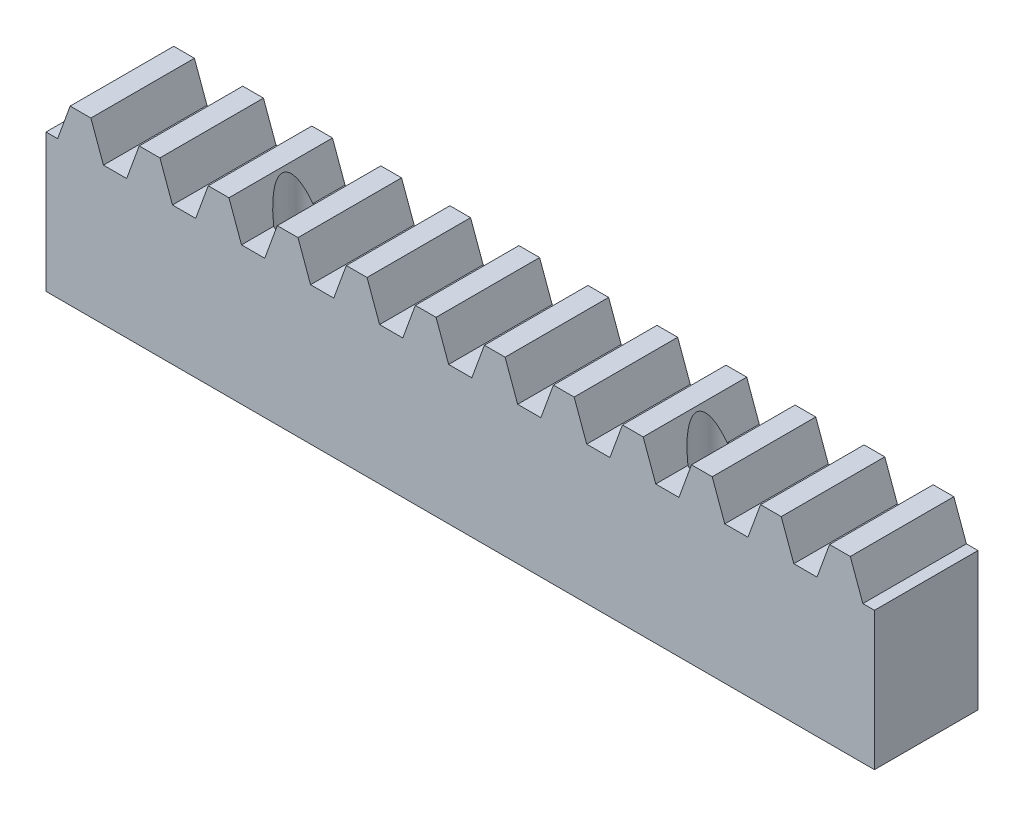
from build123d import *

# Parameters (mm, degrees)
EXTRUDE_START       = -7.5
EXTRUDE_1_DEPTH     = 15
SKETCH_2_R          = 5.5
CUT_EXTRUDE_1_DEPTH = 6
SKETCH_3_R          = 3.3
CUT_EXTRUDE_2_DEPTH = 123.805740908


# Read off the part's stored shape, not the designer's step: 凸台-拉伸1
with BuildPart() as part:
    # 凸台-拉伸1 outline → 凸台-拉伸1 (new body)
    with BuildSketch(Plane.XY.offset(EXTRUDE_START)):
        Polygon((0, 0), (120, 0), (120, 20), (118.319851, 20), (116.5, 25), (113.5, 25), (111.680149, 20), (108.319851, 20), (106.5, 25), (103.5, 25), (101.680149, 20), (98.319851, 20), (96.5, 25), (93.5, 25), (91.680149, 20), (88.319851, 20), (86.5, 25), (83.5, 25), (81.680149, 20), (78.319851, 20), (76.5, 25), (73.5, 25), (71.680149, 20), (68.319851, 20), (66.5, 25), (63.5, 25), (61.680149, 20), (58.319851, 20), (56.5, 25), (53.5, 25), (51.680149, 20), (48.319851, 20), (46.5, 25), (43.5, 25), (41.680149, 20), (38.319851, 20), (36.5, 25), (33.5, 25), (31.680149, 20), (28.319851, 20), (26.5, 25), (23.5, 25), (21.680149, 20), (18.319851, 20), (16.5, 25), (13.5, 25), (11.680149, 20), (8.319851, 20), (6.5, 25), (3.5, 25), (1.680149, 20), (0, 20), align=None)
    extrude(amount=EXTRUDE_1_DEPTH)

    # 草图2 → 切除-拉伸1 (cut)
    with BuildSketch(Plane(origin=(0, 0, 0), x_dir=(1, 0, 0), z_dir=(0, 1, 0))):
        with Locations(Location((30, 0, 0), (0, 0, 270))):
            Circle(SKETCH_2_R)
        with Locations(Location((90, 0, 0), (0, 0, 270))):
            Circle(SKETCH_2_R)
    extrude(amount=CUT_EXTRUDE_1_DEPTH, mode=Mode.SUBTRACT)

    # 草图3 → 切除-拉伸2 (cut, through all)
    with BuildSketch(Plane(origin=(0, 0, 0), x_dir=(1, 0, 0), z_dir=(0, 1, 0))):
        with Locations(Location((30, 0, 0), (0, 0, 120.606300293))):
            Circle(SKETCH_3_R)
        with Locations(Location((90, 0, 0), (0, 0, 120.606300293))):
            Circle(SKETCH_3_R)
    extrude(amount=CUT_EXTRUDE_2_DEPTH, mode=Mode.SUBTRACT)


solid = part.part
